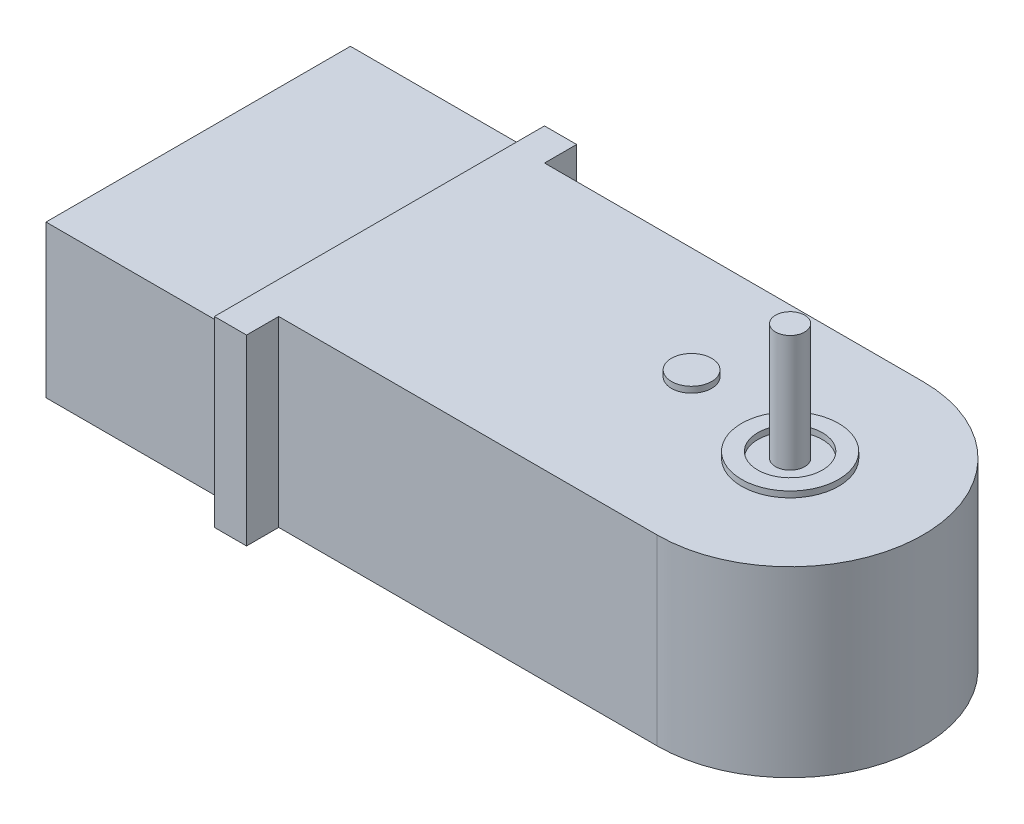
from build123d import *

# Parameters (mm, degrees)
GEAR_BOX_DEPTH      = 6.86
GEAR_BOX_DEPTH_BACK = 6.86
MOTOR_DEPTH         = 5.715
MOTOR_DEPTH_BACK    = 5.715
SKETCH2_W           = 13.61
SKETCH2_H           = 22.86
SKETCH3_R           = 1.51
SKETCH3_R_2         = 3.645
SKETCH3_R_3         = 2.43
SPACER_DEPTH        = 0.45
SPACER_BACK_START   = 0.45
SKETCH5_R           = 3.645
SKETCH5_R_2         = 2.43
SPACER_BACK_DEPTH   = 0.45
SKETCH4_R           = 1.095
OUTPUT_SHAFT_DEPTH  = 8.76


with BuildPart() as part:
    # Sketch1 → Gear Box (new, two sides: drawn at the far end of the back side and taken through both)
    with BuildSketch(Plane(origin=(0, 0, 0), x_dir=(1, 0, 0), z_dir=(0, 1, 0)).offset(-GEAR_BOX_DEPTH_BACK)):
        with BuildLine():
            Line((0, 9.98), (-28.425, 9.98))
            Line((-28.425, 9.98), (-28.425, 12.395))
            Line((-28.425, 12.395), (-30.84, 12.395))
            Line((-30.84, 12.395), (-30.84, -12.395))
            Line((-30.84, -12.395), (-28.425, -12.395))
            Line((-28.425, -12.395), (-28.425, -9.98))
            Line((-28.425, -9.98), (0, -9.98))
            ThreePointArc((0, -9.98), (9.98, 0), (0, 9.98))
        make_face()
    extrude(amount=GEAR_BOX_DEPTH + GEAR_BOX_DEPTH_BACK)

    # Sketch2 → Motor (add, two sides: drawn at the far end of the back side and taken through both)
    with BuildSketch(Plane(origin=(0, 0, 0), x_dir=(1, 0, 0), z_dir=(0, 1, 0)).offset(-MOTOR_DEPTH_BACK)):
        with Locations((-37.645, 0)):
            Rectangle(SKETCH2_W, SKETCH2_H)
    extrude(amount=MOTOR_DEPTH + MOTOR_DEPTH_BACK)

    # Sketch3 → Spacer (add)
    # profile 1 of 2: a face of its own
    with BuildSketch(Plane(origin=(0, 6.86, 0), x_dir=(1, 0, 0), z_dir=(0, 1, 0))):
        with Locations((-9, 1.6)):
            Circle(SKETCH3_R)
    # profile 2 of 2: a face of its own
    with BuildSketch(Plane(origin=(0, 6.86, 0), x_dir=(1, 0, 0), z_dir=(0, 1, 0))):
        Circle(SKETCH3_R_2)
        Circle(SKETCH3_R_3, mode=Mode.SUBTRACT)
    extrude(amount=SPACER_DEPTH)

    # Sketch5 → Spacer(back) (add)
    with BuildSketch(Plane.XZ.offset(6.86).offset(SPACER_BACK_START)):
        Circle(SKETCH5_R)
        Circle(SKETCH5_R_2, mode=Mode.SUBTRACT)
    extrude(amount=-SPACER_BACK_DEPTH)

    # Sketch4 → Output Shaft (add)
    with BuildSketch(Plane(origin=(0, 6.86, 0), x_dir=(1, 0, 0), z_dir=(0, 1, 0))):
        Circle(SKETCH4_R)
    extrude(amount=OUTPUT_SHAFT_DEPTH)


solid = part.part
